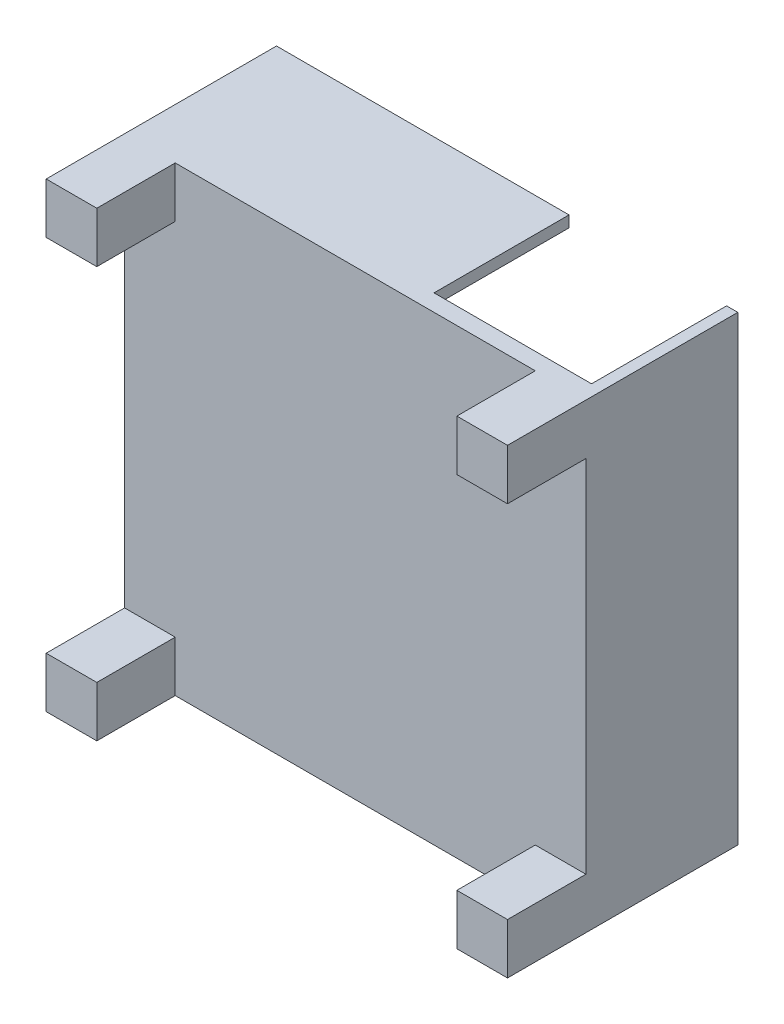
from build123d import *

# Parameters (mm, degrees)
SCHIZZO1_W                   = 41
SCHIZZO1_H                   = 41
ESTRUSIONE_ESTRUSIONE1_DEPTH = 1.5
SCHIZZO5_W                   = 4.5
SCHIZZO5_H                   = 4.5
ESTRUSIONE_ESTRUSIONE2_DEPTH = 6.97
SCHIZZO6_W                   = 4.5
SCHIZZO6_H                   = 4.5
ESTRUSIONE_ESTRUSIONE3_DEPTH = 6.97
SCHIZZO7_W                   = 4.5
SCHIZZO7_H                   = 4.5
ESTRUSIONE_ESTRUSIONE4_DEPTH = 6.97
SCHIZZO8_W                   = 4.5
SCHIZZO8_H                   = 4.5
ESTRUSIONE_ESTRUSIONE5_DEPTH = 6.97
SCHIZZO9_W                   = 1
SCHIZZO9_H                   = 41
ESTRUSIONE_ESTRUSIONE6_DEPTH = 12
SCHIZZO10_W                  = 26
SCHIZZO10_H                  = 1
ESTRUSIONE_ESTRUSIONE7_DEPTH = 12


with BuildPart() as part:
    # Schizzo1 → Estrusione-Estrusione1 (new body)
    with BuildSketch(Plane.XY):
        with Locations((20.5, 20.5)):
            Rectangle(SCHIZZO1_W, SCHIZZO1_H)
    extrude(amount=ESTRUSIONE_ESTRUSIONE1_DEPTH)

    # Schizzo5 → Estrusione-Estrusione2 (add)
    with BuildSketch(Plane.XY.offset(1.5)):
        with Locations((2.25, 2.25)):
            Rectangle(SCHIZZO5_W, SCHIZZO5_H)
    extrude(amount=ESTRUSIONE_ESTRUSIONE2_DEPTH)

    # Schizzo6 → Estrusione-Estrusione3 (add)
    with BuildSketch(Plane.XY.offset(1.5)):
        with Locations((38.75, 2.25)):
            Rectangle(SCHIZZO6_W, SCHIZZO6_H)
    extrude(amount=ESTRUSIONE_ESTRUSIONE3_DEPTH)

    # Schizzo7 → Estrusione-Estrusione4 (add)
    with BuildSketch(Plane.XY.offset(1.5)):
        with Locations((2.25, 38.75)):
            Rectangle(SCHIZZO7_W, SCHIZZO7_H)
    extrude(amount=ESTRUSIONE_ESTRUSIONE4_DEPTH)

    # Schizzo8 → Estrusione-Estrusione5 (add)
    with BuildSketch(Plane.XY.offset(1.5)):
        with Locations((38.75, 38.75)):
            Rectangle(SCHIZZO8_W, SCHIZZO8_H)
    extrude(amount=ESTRUSIONE_ESTRUSIONE5_DEPTH)

    # Schizzo9 → Estrusione-Estrusione6 (add)
    with BuildSketch(Plane(origin=(0, 0, 0), x_dir=(-1, 0, 0), z_dir=(0, 0, -1))):
        with Locations((-40.5, 20.5)):
            Rectangle(SCHIZZO9_W, SCHIZZO9_H)
    extrude(amount=ESTRUSIONE_ESTRUSIONE6_DEPTH)

    # Schizzo10 → Estrusione-Estrusione7 (add)
    with BuildSketch(Plane(origin=(0, 0, 0), x_dir=(-1, 0, 0), z_dir=(0, 0, -1))):
        with Locations((-13, 40.5)):
            Rectangle(SCHIZZO10_W, SCHIZZO10_H)
    extrude(amount=ESTRUSIONE_ESTRUSIONE7_DEPTH)


solid = part.part
